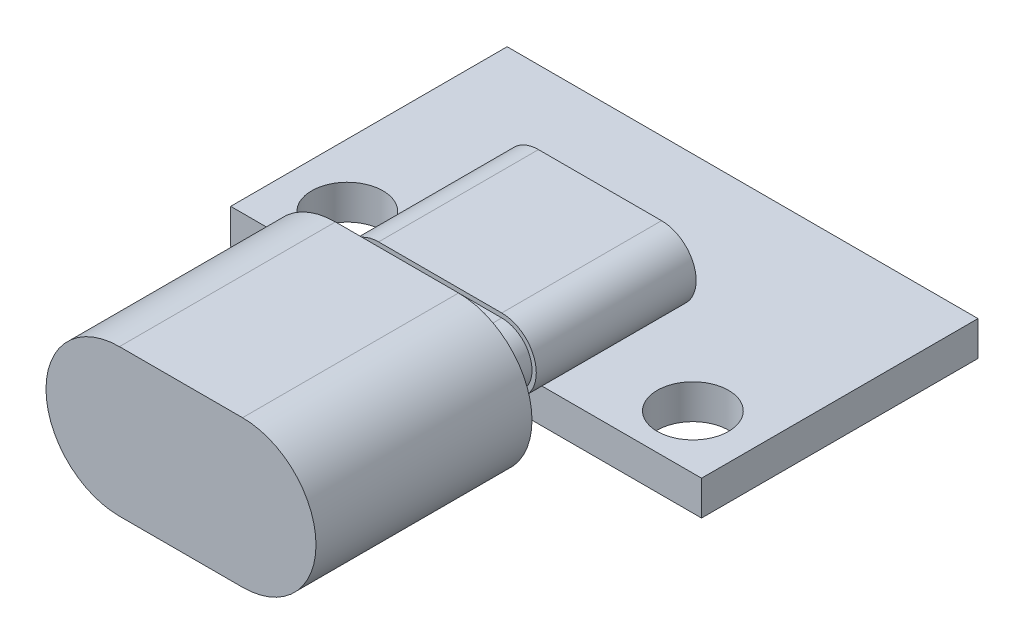
from build123d import *

# Parameters (mm, degrees)
SKETCH1_W           = 21.8
SKETCH1_H           = 12.8
BOSS_EXTRUDE1_DEPTH = 1.6
SKETCH2_R           = 1.65
CUT_EXTRUDE1_DEPTH  = 1.6
BOSS_EXTRUDE2_DEPTH = 7.4
BOSS_EXTRUDE3_DEPTH = 2
BOSS_EXTRUDE4_DEPTH = 10


with BuildPart() as part:
    # Sketch1 → Boss-Extrude1 (new body)
    with BuildSketch(Plane(origin=(0, 0, 0), x_dir=(1, 0, 0), z_dir=(0, 1, 0))):
        Rectangle(SKETCH1_W, SKETCH1_H)
    extrude(amount=BOSS_EXTRUDE1_DEPTH)

    # Sketch2 → Cut-Extrude1 (cut)
    with BuildSketch(Plane(origin=(0, 1.6, 0), x_dir=(1, 0, 0), z_dir=(0, 1, 0))):
        with Locations((-8, -3.9)):
            Circle(SKETCH2_R)
        with Locations((8, -3.9)):
            Circle(SKETCH2_R)
    extrude(amount=-CUT_EXTRUDE1_DEPTH, mode=Mode.SUBTRACT)

    # Sketch3 → Boss-Extrude2 (add)
    with BuildSketch(Plane.XY.offset(7.6)):
        with BuildLine():
            Line((-2.85, 4.8), (2.85, 4.8))
            ThreePointArc((2.85, 4.8), (4.45, 3.2), (2.85, 1.6))
            Line((2.85, 1.6), (-2.85, 1.6))
            ThreePointArc((-2.85, 1.6), (-4.45, 3.2), (-2.85, 4.8))
        make_face()
    extrude(amount=-BOSS_EXTRUDE2_DEPTH)

    # Sketch4 → Boss-Extrude3 (add)
    with BuildSketch(Plane.XY.offset(7.6)):
        with BuildLine():
            Line((-2.85, 1.8), (2.85, 1.8))
            ThreePointArc((2.85, 1.8), (4.25, 3.2), (2.85, 4.6))
            Line((2.85, 4.6), (-2.85, 4.6))
            ThreePointArc((-2.85, 4.6), (-4.25, 3.2), (-2.85, 1.8))
        make_face()
    extrude(amount=BOSS_EXTRUDE3_DEPTH)

    # Sketch5 → Boss-Extrude4 (add)
    with BuildSketch(Plane.XY.offset(9.6)):
        with BuildLine():
            Line((-2.85, -0.2), (2.85, -0.2))
            ThreePointArc((2.85, -0.2), (6.25, 3.2), (2.85, 6.6))
            Line((2.85, 6.6), (-2.85, 6.6))
            ThreePointArc((-2.85, 6.6), (-6.25, 3.2), (-2.85, -0.2))
        make_face()
    extrude(amount=BOSS_EXTRUDE4_DEPTH)


with BuildPart() as body_2:
    # Split1: the piece on the far side of the plane
    add(part.part)
    split(bisect_by=Plane(origin=(-2.85, 3.2, 7.6), x_dir=(1, 0, 0), z_dir=(0, 0, 1)), keep=Keep.BOTTOM)


with BuildPart() as part_1:
    add(part.part)

    # Split1
    split(bisect_by=Plane(origin=(-2.85, 3.2, 7.6), x_dir=(1, 0, 0), z_dir=(0, 0, 1)), keep=Keep.TOP)


solid = Compound([body_2.part, part_1.part])
